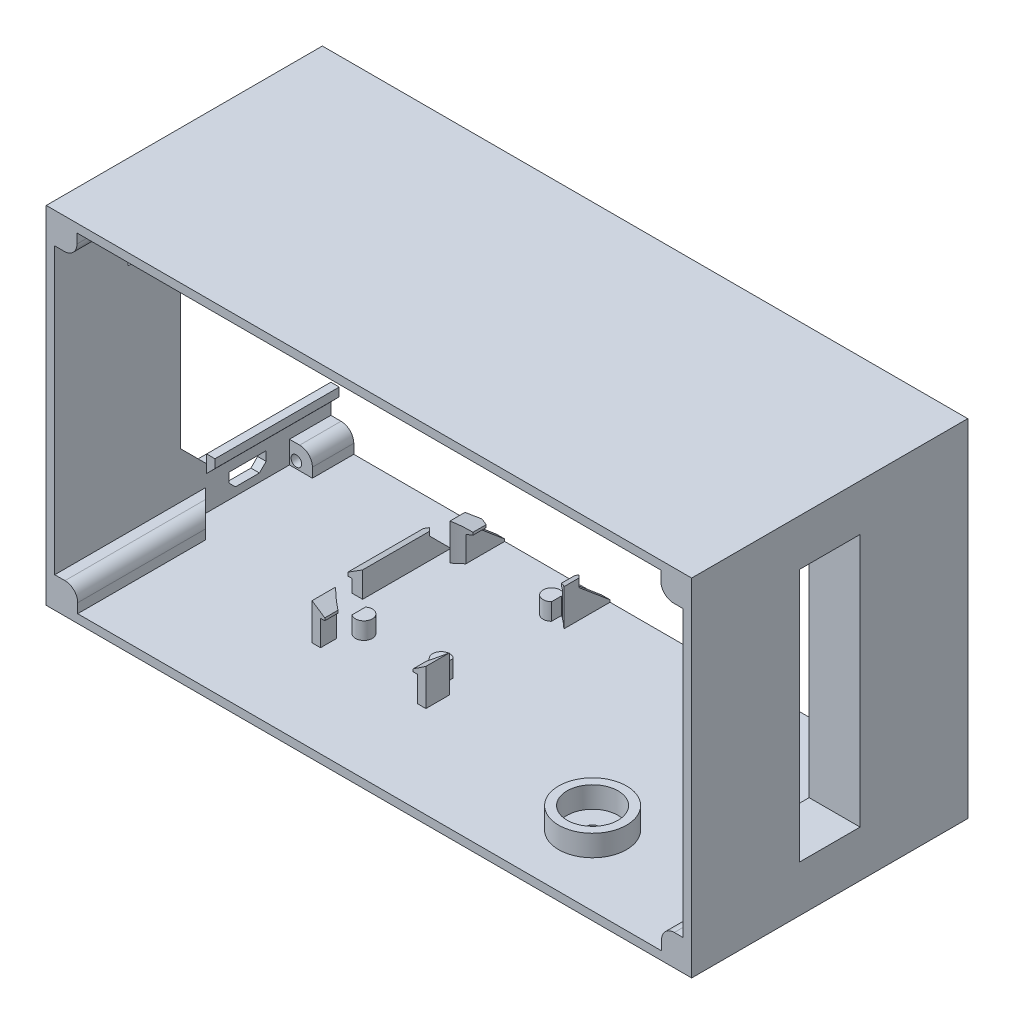
from build123d import *

# Parameters (mm, degrees)
ESQUISSE1_W              = 151.93976922
ESQUISSE1_H              = 81.544216856
BOSS_EXTRU_1_DEPTH       = 65
ESQUISSE5_R              = 2.80631591
ESQUISSE5_R_2            = 2.552975963
ESQUISSE5_R_3            = 2.661005741
BOSS_EXTRU_3_DEPTH       = 5
ESQUISSE6_W              = 12.938
ESQUISSE6_H              = 11.795
ENL_V_MAT_EXTRU_1_DEPTH  = 2
ENL_V_MAT_EXTRU_2_REACH  = 160.754
ESQUISSE7_W              = 6.242640687
ESQUISSE7_H              = 19.78
CONG_1_R                 = 3
ESQUISSE8_W              = 2.487347442
ESQUISSE8_H              = 17.78
BOSS_EXTRU_4_DEPTH       = 3
BOSS_EXTRU_5_DEPTH       = 17.78
CHANFREIN1_SIZE          = 3
ENL_V_MAT_EXTRU_5_REACH  = 160.754
ESQUISSE11_W             = 14.3
ESQUISSE11_H             = 59.66
ENL_V_MAT_EXTRU_6_DEPTH  = 10
ESQUISSE12_W             = 18.3
ESQUISSE12_H             = 63.66
ESQUISSE12_W_2           = 14.3
ESQUISSE12_H_2           = 59.66
BOSS_EXTRU_6_DEPTH       = 10
ENL_V_MAT_EXTRU_7_REACH  = 157.392
CHANFREIN3_SIZE          = 5
CHANFREIN3_SIZE2         = 6.373774392
ESQUISSE16_R             = 2
BOSS_EXTRU_8_DEPTH       = 4
ESQUISSE19_W             = 2
ESQUISSE19_H             = 38
BOSS_EXTRU_10_DEPTH      = 5.6
BOSS_EXTRU_11_DEPTH      = 38.000002
ESQUISSE22_R             = 8
ESQUISSE22_R_2           = 6
BOSS_EXTRU_12_DEPTH      = 5
ESQUISSE23_R             = 1.5
ENL_V_MAT_EXTRU_8_DEPTH  = 5
CHANFREIN4_SIZE          = 5.958767963
CHANFREIN4_SIZE_2        = 5
ENL_V_START              = -4
ENL_V_MAT_EXTRU_9_DEPTH  = 8.6
CHANFREIN5_SIZE          = 2
ENL_V_MAT_EXTRU_10_DEPTH = 2
ESQUISSE27_R             = 1
BOSS_EXTRU_13_DEPTH      = 29.24816
ENL_V_START_2            = -10
ESQUISSE28_R             = 4.190033769
ENL_V_MAT_EXTRU_11_DEPTH = 10
BOSS_EXTRU_14_DEPTH      = 29.24816
BOSS_EXTRU_15_START      = -2
ESQUISSE30_R             = 1
BOSS_EXTRU_15_DEPTH      = 2
ESQUISSE31_R             = 1.25
ENL_V_MAT_EXTRU_12_DEPTH = 15


# Some blends are built 0.0001 mm under size
with BuildPart() as part:
    # Esquisse1 → Boss.-Extru.1 (new body)
    with BuildSketch(Plane(origin=(0, 0, -2.2), x_dir=(-1, 0, 0), z_dir=(0, 0, -1))):
        with Locations((43.862390942, -0.866617279)):
            Rectangle(ESQUISSE1_W, ESQUISSE1_H)
        with BuildLine():
            Line((117.832275552, 32.662850462), (117.832275552, -34.39608502))
            Line((117.832275552, -34.39608502), (115.428546177, -34.39608502))
            ThreePointArc((115.428546177, -34.39608502), (113.307225834, -35.274764676), (112.428546177, -37.39608502))
            Line((112.428546177, -37.39608502), (112.428546177, -39.638725707))
            Line((112.428546177, -39.638725707), (-25.025941668, -39.638725707))
            Line((-25.025941668, -39.638725707), (-25.025941668, -37.39608502))
            ThreePointArc((-25.025941668, -37.39608502), (-25.904621324, -35.274764676), (-28.025941668, -34.39608502))
            Line((-28.025941668, -34.39608502), (-30.107493668, -34.39608502))
            Line((-30.107493668, -34.39608502), (-30.107493668, 32.662850462))
            Line((-30.107493668, 32.662850462), (-27.864852981, 32.662850462))
            ThreePointArc((-27.864852981, 32.662850462), (-25.743532637, 33.541530119), (-24.864852981, 35.662850462))
            Line((-24.864852981, 35.662850462), (-24.864852981, 37.905491149))
            Line((-24.864852981, 37.905491149), (112.589634865, 37.905491149))
            Line((112.589634865, 37.905491149), (112.589634865, 35.662850462))
            ThreePointArc((112.589634865, 35.662850462), (113.468314521, 33.541530119), (115.589634865, 32.662850462))
            Line((115.589634865, 32.662850462), (117.832275552, 32.662850462))
        make_face(mode=Mode.SUBTRACT)
    extrude(amount=BOSS_EXTRU_1_DEPTH)

    # Esquisse5 → Boss.-Extru.3 (add)
    with BuildSketch(Plane.XZ.offset(-37.905491149)):
        with Locations(Location((-16.733675552, -61.521007893, 0), (0, 0, 90))):
            Circle(ESQUISSE5_R)
        with Locations(Location((-99.359875552, -61.521007893, 0), (0, 0, 90))):
            Circle(ESQUISSE5_R_2)
        with Locations(Location((-99.359875552, -13.184807893, 0), (0, 0, 90))):
            Circle(ESQUISSE5_R_3)
    extrude(amount=BOSS_EXTRU_3_DEPTH)

    # Esquisse6 → Enlèv. mat.-Extru.1 (cut)
    with BuildSketch(Plane.ZY.offset(119.832275552)):
        with Locations((-25.884807893, 25.856991149)):
            Rectangle(ESQUISSE6_W, ESQUISSE6_H)
        Polygon((-51.966426196, -33.988725707), (-43.166426196, -33.988725707), (-43.166426196, -36.163725707), (-44.741426196, -37.738725707), (-50.391426196, -37.738725707), (-51.966426196, -36.163725707), align=None)
    extrude(amount=-ENL_V_MAT_EXTRU_1_DEPTH, mode=Mode.SUBTRACT)

    # Enlèv. mat.-Extru.2: up to this face of the body (flat: up to its plane)
    enl_v_mat_extru_2_end = Plane(part.part.faces().sort_by_distance((-116.630410864, -34.39608502, -34.7))[0])
    # Esquisse7 → Enlèv. mat.-Extru.2 (cut, up to the picked face)
    with BuildSketch(Plane(origin=(0, -39.638725707, 0), x_dir=(1, 0, 0), z_dir=(0, 1, 0)), mode=Mode.PRIVATE) as enl_v_mat_extru_2_sk1:
        with Locations((-114.710955209, 47.566426196)):
            Rectangle(ESQUISSE7_W, ESQUISSE7_H)
    enl_v_mat_extru_2_tool1 = split(extrude(enl_v_mat_extru_2_sk1.sketch, amount=ENL_V_MAT_EXTRU_2_REACH, mode=Mode.PRIVATE), bisect_by=enl_v_mat_extru_2_end, keep=Keep.BOTH, mode=Mode.PRIVATE)
    add(enl_v_mat_extru_2_tool1.solids().sort_by(Axis((-114.710955, -39.638726, -47.566426), (0, 1, 0)))[0], mode=Mode.SUBTRACT)

    # Congé1
    cong_1_edges = [part.edges().sort_by_distance(p)[0] for p in [
        (-16.733675552, 37.905491149, -64.327323803),
        (-99.359875552, 37.905491149, -64.073983856),
        (-99.359875552, 37.905491149, -15.845813634),
    ]]
    fillet(cong_1_edges, radius=CONG_1_R)

    # Esquisse8 → Boss.-Extru.4 (add)
    with BuildSketch(Plane(origin=(0, -39.638725707, 0), x_dir=(1, 0, 0), z_dir=(0, 1, 0))):
        with Locations((-83.068601831, 47.566426196)):
            Rectangle(ESQUISSE8_W, ESQUISSE8_H)
    extrude(amount=BOSS_EXTRU_4_DEPTH)

    # Esquisse9 → Boss.-Extru.5 (add)
    with BuildSketch(Plane(origin=(0, 0, -56.456426196), x_dir=(-1, 0, 0), z_dir=(0, 0, -1))):
        Polygon((81.82492811, -36.638725707), (85.312275552, -36.638725707), (85.312275552, -35.838725707), (81.82492811, -33.638725707), align=None)
    extrude(amount=-BOSS_EXTRU_5_DEPTH)

    # Chanfrein1
    chanfrein1_edges = [part.edges().sort_by_distance(p)[0] for p in [
        (-83.068601831, -39.638725707, -56.456426196),
    ]]
    chamfer(chanfrein1_edges, length=CHANFREIN1_SIZE)

    # Enlèv. mat.-Extru.5: up to this face of the body (flat: up to its plane)
    enl_v_mat_extru_5_end = Plane(part.part.faces().sort_by_distance((-116.630410864, -34.39608502, -19.938213098))[0])
    # Esquisse10 → Enlèv. mat.-Extru.5 (cut, up to the picked face)
    with BuildSketch(Plane(origin=(0, -39.638725707, 0), x_dir=(1, 0, 0), z_dir=(0, 1, 0)), mode=Mode.PRIVATE) as enl_v_mat_extru_5_sk1:
        Polygon((-117.832275552, 37.676426196), (-112.428546177, 32.272696822), (-112.428546177, 37.676426196), align=None)
    enl_v_mat_extru_5_tool1 = split(extrude(enl_v_mat_extru_5_sk1.sketch, amount=ENL_V_MAT_EXTRU_5_REACH, mode=Mode.PRIVATE), bisect_by=enl_v_mat_extru_5_end, keep=Keep.BOTH, mode=Mode.PRIVATE)
    add(enl_v_mat_extru_5_tool1.solids().sort_by(Axis((-114.229789, -39.638726, -35.875183), (0, 1, 0)))[0], mode=Mode.SUBTRACT)

    # Esquisse11 → Enlèv. mat.-Extru.6 (cut)
    with BuildSketch(Plane(origin=(32.107493668, 0, 0), x_dir=(0, 0, -1), z_dir=(1, 0, 0))):
        with Locations((34.7, -0.866617279)):
            Rectangle(ESQUISSE11_W, ESQUISSE11_H)
    extrude(amount=-ENL_V_MAT_EXTRU_6_DEPTH, mode=Mode.SUBTRACT)

    # Esquisse12 → Boss.-Extru.6 (add)
    with BuildSketch(Plane.ZY.offset(-30.107493668)):
        with Locations((-34.7, -0.866617279)):
            Rectangle(ESQUISSE12_W, ESQUISSE12_H)
        with Locations((-34.7, -0.866617279)):
            Rectangle(ESQUISSE12_W_2, ESQUISSE12_H_2, mode=Mode.SUBTRACT)
    extrude(amount=BOSS_EXTRU_6_DEPTH)

    # Esquisse13 → Enlèv. mat.-Extru.7 (cut, up to next)
    with BuildSketch(Plane(origin=(0, 30.963382721, 0), x_dir=(1, 0, 0), z_dir=(0, 1, 0)), mode=Mode.PRIVATE) as enl_v_mat_extru_7_sk1:
        Polygon((30.107493668, 43.85), (20.107493668, 41.85), (20.107493668, 43.85), align=None)
    enl_v_mat_extru_7_tool1 = extrude(enl_v_mat_extru_7_sk1.sketch, amount=-ENL_V_MAT_EXTRU_7_REACH, mode=Mode.PRIVATE) & part.part
    add(enl_v_mat_extru_7_tool1.solids().sort_by_distance((23.440827, 30.963383, -43.183333))[0], mode=Mode.SUBTRACT)

    # Chanfrein3
    chanfrein3_edges = [part.edges().sort_by_distance(p)[0] for p in [
        (30.107493668, -0.866617279, -43.85),
    ]]
    chanfrein3_side = [part.faces().sort_by_distance(p)[0] for p in [
        (30.107493668, -33.462173845, -34.7),
    ]]
    chamfer(chanfrein3_edges, length=CHANFREIN3_SIZE, length2=CHANFREIN3_SIZE2, reference=chanfrein3_side[0])

    # Esquisse16 → Boss.-Extru.8 (add)
    with BuildSketch(Plane(origin=(0, -39.638725707, 0), x_dir=(1, 0, 0), z_dir=(0, 1, 0))):
        with Locations(Location((-56.506793474, 31.848861628, 0), (0, 0, 270))):
            Circle(ESQUISSE16_R)
        with Locations(Location((-74.703845435, 31.848861628, 0), (0, 0, 270))):
            Circle(ESQUISSE16_R)
        with Locations(Location((-56.506793474, 57.848861628, 0), (0, 0, 270))):
            Circle(ESQUISSE16_R)
    extrude(amount=BOSS_EXTRU_8_DEPTH)

    # Esquisse19 → Boss.-Extru.10 (add)
    with BuildSketch(Plane(origin=(0, -39.638725707, 0), x_dir=(1, 0, 0), z_dir=(0, 1, 0))):
        with Locations((-53.106793474, 42.848861628)):
            Rectangle(ESQUISSE19_W, ESQUISSE19_H)
        with Locations((-77.906793474, 42.848861628)):
            Rectangle(ESQUISSE19_W, ESQUISSE19_H)
    extrude(amount=BOSS_EXTRU_10_DEPTH)

    # Esquisse20 → Boss.-Extru.11 (add)
    with BuildSketch(Plane(origin=(0, 0, -61.848861628), x_dir=(-1, 0, 0), z_dir=(0, 0, -1))):
        Polygon((52.106793474, -34.038725707), (52.106793474, -31.038725707), (55.106793474, -33.038725707), (55.106793474, -33.638725707), (54.106793474, -33.638725707), (54.106793474, -34.038725707), align=None)
        Polygon((76.906793474, -34.038725707), (78.906793474, -34.038725707), (78.906793474, -31.038725707), (75.906793474, -33.038725707), (75.906793474, -33.638725707), (76.906793474, -33.638725707), align=None)
    extrude(amount=-BOSS_EXTRU_11_DEPTH)

    # Esquisse22 → Boss.-Extru.12 (add)
    with BuildSketch(Plane(origin=(0, -39.638725707, 0), x_dir=(1, 0, 0), z_dir=(0, 1, 0))):
        with Locations(Location((-7.714798037, 18.700701782, 0), (0, 0, 180))):
            Circle(ESQUISSE22_R)
        with Locations(Location((-7.714798037, 18.700701782, 0), (0, 0, 270))):
            Circle(ESQUISSE22_R_2, mode=Mode.SUBTRACT)
    extrude(amount=BOSS_EXTRU_12_DEPTH)

    # Esquisse23 → Enlèv. mat.-Extru.8 (cut)
    with BuildSketch(Plane.XZ.offset(41.638725707)):
        with Locations(Location((-7.714798037, -18.700701782, 0), (0, 0, 270))):
            Circle(ESQUISSE23_R)
    extrude(amount=-ENL_V_MAT_EXTRU_8_DEPTH, mode=Mode.SUBTRACT)

    # Chanfrein4
    # the kernel refuses this chamfer: 5.958767963, 5 mm, written as the material it adds along each edge
    with BuildSketch(Plane(origin=(-52.106793474, -39.638725707, -61.848861628), x_dir=(0, -0.024939322090233973, -0.9996889667359942), z_dir=(-1, 0, 0))) as chanfrein4_piece_1_section:
        Polygon((CHANFREIN4_SIZE * 0.999688966731, -CHANFREIN4_SIZE * 0.0249393220901), (-CHANFREIN4_SIZE_2 * 0.0249393220902, -CHANFREIN4_SIZE_2 * 0.999688966736), (0, 0), align=None)
    chanfrein4_piece_1 = extrude(amount=2, mode=Mode.PRIVATE)
    chanfrein4_piece_1 = split(chanfrein4_piece_1, bisect_by=Plane(origin=(-53.106793474, -37.967772617, -67.2), z_dir=(0, 0, 1)), keep=Keep.TOP, mode=Mode.PRIVATE)
    add(chanfrein4_piece_1)
    with BuildSketch(Plane(origin=(-78.906793474, -39.638725707, -61.848861628), x_dir=(0, -0.024939322090235132, -0.9996889667359942), z_dir=(1, 0, 0))) as chanfrein4_piece_2_section:
        Polygon((CHANFREIN4_SIZE * 0.999688966731, CHANFREIN4_SIZE * 0.0249393220901), (-CHANFREIN4_SIZE_2 * 0.0249393220902, CHANFREIN4_SIZE_2 * 0.999688966736), (0, 0), align=None)
    chanfrein4_piece_2 = extrude(amount=2, mode=Mode.PRIVATE)
    chanfrein4_piece_2 = split(chanfrein4_piece_2, bisect_by=Plane(origin=(-77.906793474, -37.967772617, -67.2), z_dir=(0, 0, 1)), keep=Keep.TOP, mode=Mode.PRIVATE)
    add(chanfrein4_piece_2)

    # Esquisse25 → Enlèv. mat.-Extru.9 (cut)
    with BuildSketch(Plane(origin=(0, -35.638725707, 0), x_dir=(1, 0, 0), z_dir=(0, 1, 0)).offset(ENL_V_START)):
        with BuildLine():
            Line((-52.106793474, 29.378895036), (-52.106793474, 56.318828221))
            ThreePointArc((-52.106793474, 56.318828221), (-53.544878409, 57.610724247), (-55.106793474, 58.749804997))
            Line((-55.106793474, 58.749804997), (-55.106793474, 26.94791826))
            ThreePointArc((-55.106793474, 26.94791826), (-53.544878409, 28.08699901), (-52.106793474, 29.378895036))
        make_face()
        with BuildLine():
            Line((-78.906793474, 29.378895036), (-78.906793474, 56.318828221))
            ThreePointArc((-78.906793474, 56.318828221), (-77.468708539, 57.610724247), (-75.906793474, 58.749804997))
            Line((-75.906793474, 58.749804997), (-75.906793474, 26.94791826))
            ThreePointArc((-75.906793474, 26.94791826), (-77.468708539, 28.08699901), (-78.906793474, 29.378895036))
        make_face()
    extrude(amount=ENL_V_MAT_EXTRU_9_DEPTH, mode=Mode.SUBTRACT)

    # Chanfrein5
    chanfrein5_edges = [part.edges().sort_by_distance(p)[0] for p in [
        (-78.906793474, -32.838725707, -61.848861628),
        (-52.106793474, -32.838725707, -61.848861628),
        (-81.82492811, -35.138725707, -56.456426196),
    ]]
    chamfer(chanfrein5_edges, length=CHANFREIN5_SIZE - 0.0001)  # a hair under: the kernel refuses the full size

    # Esquisse26 → Enlèv. mat.-Extru.10 (cut)
    with BuildSketch(Plane.ZY.offset(119.832275552)):
        Polygon((-37.951840289, 15.074954872), (-31.8, 8.923114582), (-31.8, -23.486885418), (-37.951840289, -29.638725707), (-67.2, -29.638725707), (-67.2, 15.074954872), align=None)
    extrude(amount=-ENL_V_MAT_EXTRU_10_DEPTH, mode=Mode.SUBTRACT)

    # Esquisse27 → Boss.-Extru.13 (add)
    with BuildSketch(Plane(origin=(0, 0, -67.2), x_dir=(-1, 0, 0), z_dir=(0, 0, -1))):
        with BuildLine():
            ThreePointArc((117.832275552, 15.074954872), (123.619425187, 12.677839005), (121.222309321, 18.464988641))
            Line((121.222309321, 18.464988641), (119.832275552, 18.464988641))
            Line((119.832275552, 18.464988641), (119.832275552, 15.074954872))
            Line((119.832275552, 15.074954872), (117.832275552, 15.074954872))
        make_face()
        with Locations((121.222309321, 15.074954872)):
            Circle(ESQUISSE27_R, mode=Mode.SUBTRACT)
    extrude(amount=-BOSS_EXTRU_13_DEPTH)

    # Esquisse28 → Enlèv. mat.-Extru.11 (cut)
    with BuildSketch(Plane(origin=(0, 0, -67.2), x_dir=(-1, 0, 0), z_dir=(0, 0, -1)).offset(ENL_V_START_2)):
        with Locations((121.222309321, 15.074954872)):
            Circle(ESQUISSE28_R)
    extrude(amount=-ENL_V_MAT_EXTRU_11_DEPTH, mode=Mode.SUBTRACT)

    # Esquisse29 → Boss.-Extru.14 (add)
    with BuildSketch(Plane(origin=(0, 0, -67.2), x_dir=(-1, 0, 0), z_dir=(0, 0, -1))):
        Polygon((117.832275552, -27.638725707), (115.860260536, -27.638725707), (115.860260536, -29.638725707), (117.832275552, -31.638725707), align=None)
    extrude(amount=-BOSS_EXTRU_14_DEPTH)

    # Esquisse30 → Boss.-Extru.15 (add)
    with BuildSketch(Plane.XY.offset(-37.951840289).offset(BOSS_EXTRU_15_START)):
        with Locations(Location((-121.222309321, 15.074954872, 0), (0, 0, 180))):
            Circle(ESQUISSE30_R)
    extrude(amount=BOSS_EXTRU_15_DEPTH)

    # Esquisse31 → Enlèv. mat.-Extru.12 (cut)
    with BuildSketch(Plane(origin=(0, 0, -67.2), x_dir=(-1, 0, 0), z_dir=(0, 0, -1))):
        with Locations((116.210955208, -38.017405363)):
            Circle(ESQUISSE31_R)
        with Locations((-28.486173324, -38.017405363)):
            Circle(ESQUISSE31_R)
        with Locations((-28.486173324, 36.284170806)):
            Circle(ESQUISSE31_R)
        with Locations((116.210955208, 36.284170806)):
            Circle(ESQUISSE31_R)
    extrude(amount=-ENL_V_MAT_EXTRU_12_DEPTH, mode=Mode.SUBTRACT)


solid = part.part
